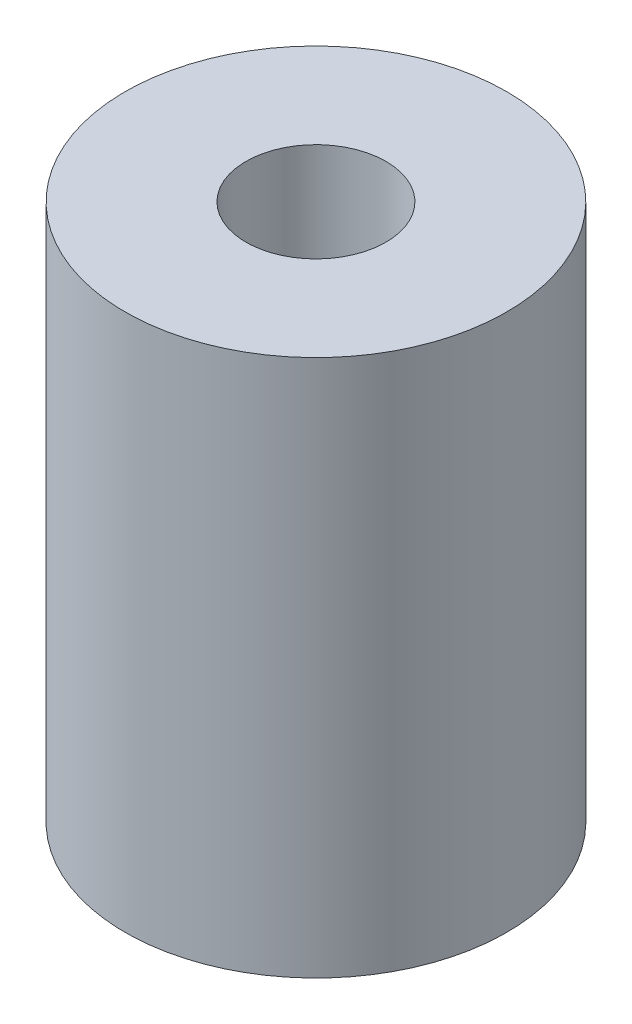
from build123d import *

# Parameters (mm, degrees)
SKETCH1_R           = 15
BOSS_EXTRUDE1_DEPTH = 42.240087484
SKETCH2_R           = 5.504267453
CUT_EXTRUDE1_DEPTH  = 48.267589219


with BuildPart() as part:
    # Sketch1 → Boss-Extrude1 (new body)
    with BuildSketch(Plane(origin=(0, 0, 0), x_dir=(1, 0, 0), z_dir=(0, 1, 0))):
        Circle(SKETCH1_R)
    extrude(amount=BOSS_EXTRUDE1_DEPTH)

    # Sketch2 → Cut-Extrude1 (cut, through all)
    with BuildSketch(Plane(origin=(0, 0, 0), x_dir=(1, 0, 0), z_dir=(0, 1, 0))):
        Circle(SKETCH2_R)
    extrude(amount=CUT_EXTRUDE1_DEPTH, mode=Mode.SUBTRACT)


solid = part.part
